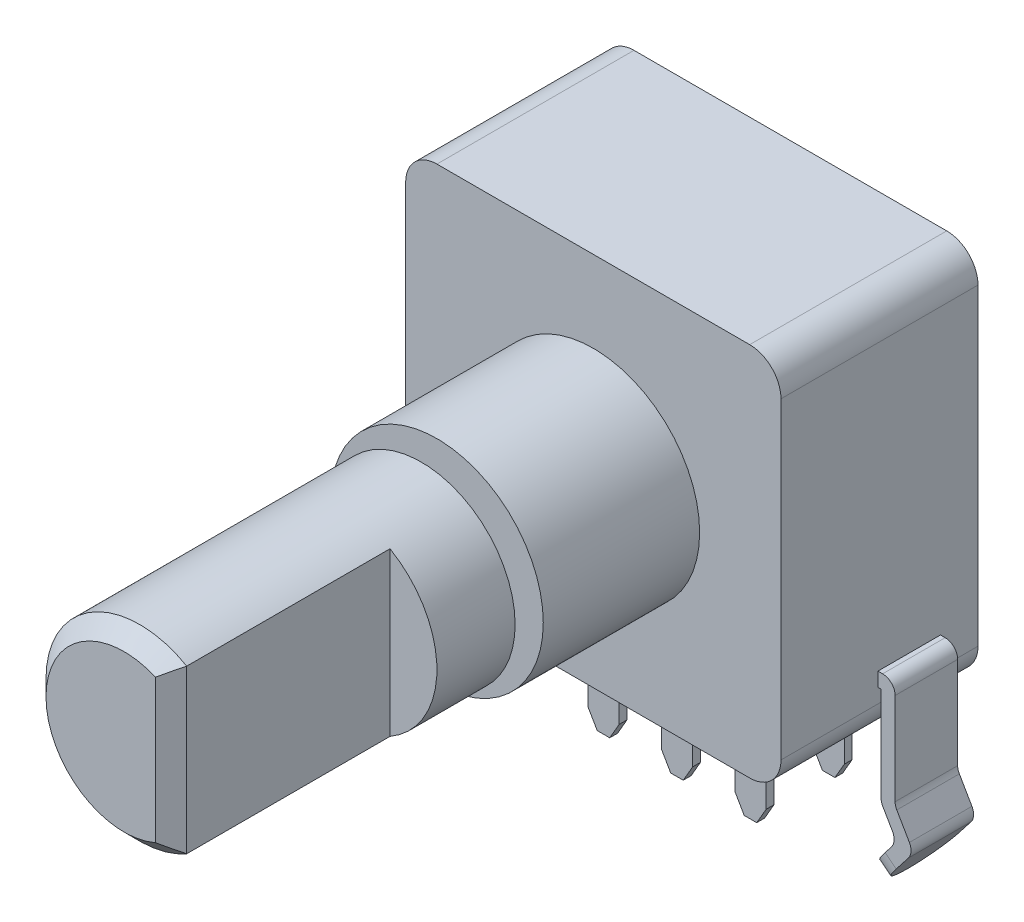
from build123d import *
from OCP.BRepFilletAPI import BRepFilletAPI_MakeChamfer

# Parameters (mm, degrees)
ESQUISSE1_W           = 12
ESQUISSE1_H           = 12
BOSS_EXTRU_1_DEPTH    = 6.3
ESQUISSE2_R           = 3.4
BOSS_EXTRU_2_DEPTH    = 5
ESQUISSE5_R           = 1.8
BOSS_EXTRU_5_DEPTH    = 0.5
ESQUISSE3_R           = 3
BOSS_EXTRU_3_DEPTH    = 2.5
BOSS_EXTRU_6_START    = 2.5
BOSS_EXTRU_6_DEPTH    = 7
ESQUISSE4_W           = 1
ESQUISSE4_H           = 0.25
BOSS_EXTRU_4_DEPTH    = 3.8
CHANFREIN1_SIZE       = 0.5
CONG_1_R              = 1
CHANFREIN2_SIZE       = 0.3
CHANFREIN2_SIZE2      = 0.519615242
BOSS_EXTRU_7_START    = -1.2
BOSS_EXTRU_7_DEPTH    = 2
CONG_2_R              = 1
CONG_2_OF_SYM_TRIE1_R = 1


with BuildPart() as part:
    # Esquisse1 → Boss.-Extru.1 (new body)
    with BuildSketch(Plane.XY):
        Rectangle(ESQUISSE1_W, ESQUISSE1_H)
    extrude(amount=BOSS_EXTRU_1_DEPTH)

    # Esquisse2 → Boss.-Extru.2 (add)
    with BuildSketch(Plane.XY.offset(6.3)):
        Circle(ESQUISSE2_R)
    extrude(amount=BOSS_EXTRU_2_DEPTH)

    # Esquisse5 → Boss.-Extru.5 (add)
    with BuildSketch(Plane.XY.offset(11.3)):
        Circle(ESQUISSE5_R)
    extrude(amount=BOSS_EXTRU_5_DEPTH)

    # Esquisse3 → Boss.-Extru.3 (add)
    with BuildSketch(Plane.XY.offset(11.8)):
        Circle(ESQUISSE3_R)
    extrude(amount=BOSS_EXTRU_3_DEPTH)

    # Esquisse3<4> → Boss.-Extru.6 (add)
    with BuildSketch(Plane.XY.offset(11.8).offset(BOSS_EXTRU_6_START)):
        with BuildLine():
            Line((1.5, 0.994987437), (1.5, 2.598076211))
            ThreePointArc((1.5, 2.598076211), (-3, 0), (1.5, -2.598076211))
            Line((1.5, -2.598076211), (1.5, -0.994987437))
            ThreePointArc((1.5, -0.994987437), (-1.8, 0), (1.5, 0.994987437))
        make_face()
        with BuildLine():
            Line((1.5, -0.994987437), (1.5, 0.994987437))
            ThreePointArc((1.5, 0.994987437), (-1.8, 0), (1.5, -0.994987437))
        make_face()
    extrude(amount=BOSS_EXTRU_6_DEPTH)

    # Esquisse4 → Boss.-Extru.4 (add)
    with BuildSketch(Plane.XZ.offset(6)):
        with Locations((0, 3.5)):
            Rectangle(ESQUISSE4_W, ESQUISSE4_H)
        with Locations((2.35, 3.5)):
            Rectangle(ESQUISSE4_W, ESQUISSE4_H)
        with Locations((-2.35, 3.5)):
            Rectangle(ESQUISSE4_W, ESQUISSE4_H)
        with Locations((-2.35, 1)):
            Rectangle(ESQUISSE4_W, ESQUISSE4_H)
        with Locations((2.35, 1)):
            Rectangle(ESQUISSE4_W, ESQUISSE4_H)
    extrude(amount=BOSS_EXTRU_4_DEPTH)

    # Chanfrein1
    chanfrein1_edges = [part.edges().sort_by_distance(p)[0] for p in [
        (1.5, 0, 21.3),
        (-3, 0, 21.3),
    ]]
    chamfer(chanfrein1_edges, length=CHANFREIN1_SIZE)

    # Congé1
    cong_1_edges = [part.edges().sort_by_distance(p)[0] for p in [
        (6, -6, 3.15),
        (-6, -6, 3.15),
        (-6, 6, 3.15),
        (6, 6, 3.15),
    ]]
    fillet(cong_1_edges, radius=CONG_1_R)

    # Chanfrein2: one chamfer whose edges measure the first distance from different faces: ONE call of the kernel's chamfer builder (chamfer() names one face for all edges)
    chanfrein2_edges_1 = [part.edges().sort_by_distance(p)[0] for p in [
        (0.5, -6, 3.5),
    ]]
    chanfrein2_side_1 = [part.faces().sort_by_distance(p)[0] for p in [
        (0.5, -7.9, 3.5),
    ]]
    chanfrein2_edges_2 = [part.edges().sort_by_distance(p)[0] for p in [
        (-0.5, -6, 3.5),
    ]]
    chanfrein2_side_2 = [part.faces().sort_by_distance(p)[0] for p in [
        (-0.5, -7.9, 3.5),
    ]]
    chanfrein2_edges_3 = [part.edges().sort_by_distance(p)[0] for p in [
        (0.5, -9.8, 3.5),
        (-0.5, -9.8, 3.5),
    ]]
    chanfrein2_side_3 = [part.faces().sort_by_distance(p)[0] for p in [
        (0, -9.8, 3.5),
    ]]
    chanfrein2_edges_4 = [part.edges().sort_by_distance(p)[0] for p in [
        (2.85, -6, 3.5),
    ]]
    chanfrein2_side_4 = [part.faces().sort_by_distance(p)[0] for p in [
        (2.85, -7.9, 3.5),
    ]]
    chanfrein2_edges_5 = [part.edges().sort_by_distance(p)[0] for p in [
        (1.85, -6, 3.5),
    ]]
    chanfrein2_side_5 = [part.faces().sort_by_distance(p)[0] for p in [
        (1.85, -7.9, 3.5),
    ]]
    chanfrein2_edges_6 = [part.edges().sort_by_distance(p)[0] for p in [
        (2.85, -9.8, 3.5),
        (1.85, -9.8, 3.5),
    ]]
    chanfrein2_side_6 = [part.faces().sort_by_distance(p)[0] for p in [
        (2.35, -9.8, 3.5),
    ]]
    chanfrein2_edges_7 = [part.edges().sort_by_distance(p)[0] for p in [
        (-1.85, -6, 3.5),
    ]]
    chanfrein2_side_7 = [part.faces().sort_by_distance(p)[0] for p in [
        (-1.85, -7.9, 3.5),
    ]]
    chanfrein2_edges_8 = [part.edges().sort_by_distance(p)[0] for p in [
        (-2.85, -6, 3.5),
    ]]
    chanfrein2_side_8 = [part.faces().sort_by_distance(p)[0] for p in [
        (-2.85, -7.9, 3.5),
    ]]
    chanfrein2_edges_9 = [part.edges().sort_by_distance(p)[0] for p in [
        (-1.85, -9.8, 3.5),
        (-2.85, -9.8, 3.5),
    ]]
    chanfrein2_side_9 = [part.faces().sort_by_distance(p)[0] for p in [
        (-2.35, -9.8, 3.5),
    ]]
    chanfrein2_edges_10 = [part.edges().sort_by_distance(p)[0] for p in [
        (-1.85, -6, 1),
    ]]
    chanfrein2_side_10 = [part.faces().sort_by_distance(p)[0] for p in [
        (-1.85, -7.9, 1),
    ]]
    chanfrein2_edges_11 = [part.edges().sort_by_distance(p)[0] for p in [
        (-2.85, -6, 1),
    ]]
    chanfrein2_side_11 = [part.faces().sort_by_distance(p)[0] for p in [
        (-2.85, -7.9, 1),
    ]]
    chanfrein2_edges_12 = [part.edges().sort_by_distance(p)[0] for p in [
        (-1.85, -9.8, 1),
        (-2.85, -9.8, 1),
    ]]
    chanfrein2_side_12 = [part.faces().sort_by_distance(p)[0] for p in [
        (-2.35, -9.8, 1),
    ]]
    chanfrein2_edges_13 = [part.edges().sort_by_distance(p)[0] for p in [
        (2.85, -6, 1),
    ]]
    chanfrein2_side_13 = [part.faces().sort_by_distance(p)[0] for p in [
        (2.85, -7.9, 1),
    ]]
    chanfrein2_edges_14 = [part.edges().sort_by_distance(p)[0] for p in [
        (1.85, -6, 1),
    ]]
    chanfrein2_side_14 = [part.faces().sort_by_distance(p)[0] for p in [
        (1.85, -7.9, 1),
    ]]
    chanfrein2_edges_15 = [part.edges().sort_by_distance(p)[0] for p in [
        (2.85, -9.8, 1),
        (1.85, -9.8, 1),
    ]]
    chanfrein2_side_15 = [part.faces().sort_by_distance(p)[0] for p in [
        (2.35, -9.8, 1),
    ]]
    chanfrein2 = BRepFilletAPI_MakeChamfer(part.part.solid().wrapped)
    for e in chanfrein2_edges_1:
        chanfrein2.Add(CHANFREIN2_SIZE, CHANFREIN2_SIZE2, e.wrapped, chanfrein2_side_1[0].wrapped)  # the first distance lies on this face
    for e in chanfrein2_edges_2:
        chanfrein2.Add(CHANFREIN2_SIZE, CHANFREIN2_SIZE2, e.wrapped, chanfrein2_side_2[0].wrapped)  # the first distance lies on this face
    for e in chanfrein2_edges_3:
        chanfrein2.Add(CHANFREIN2_SIZE, CHANFREIN2_SIZE2, e.wrapped, chanfrein2_side_3[0].wrapped)  # the first distance lies on this face
    for e in chanfrein2_edges_4:
        chanfrein2.Add(CHANFREIN2_SIZE, CHANFREIN2_SIZE2, e.wrapped, chanfrein2_side_4[0].wrapped)  # the first distance lies on this face
    for e in chanfrein2_edges_5:
        chanfrein2.Add(CHANFREIN2_SIZE, CHANFREIN2_SIZE2, e.wrapped, chanfrein2_side_5[0].wrapped)  # the first distance lies on this face
    for e in chanfrein2_edges_6:
        chanfrein2.Add(CHANFREIN2_SIZE, CHANFREIN2_SIZE2, e.wrapped, chanfrein2_side_6[0].wrapped)  # the first distance lies on this face
    for e in chanfrein2_edges_7:
        chanfrein2.Add(CHANFREIN2_SIZE, CHANFREIN2_SIZE2, e.wrapped, chanfrein2_side_7[0].wrapped)  # the first distance lies on this face
    for e in chanfrein2_edges_8:
        chanfrein2.Add(CHANFREIN2_SIZE, CHANFREIN2_SIZE2, e.wrapped, chanfrein2_side_8[0].wrapped)  # the first distance lies on this face
    for e in chanfrein2_edges_9:
        chanfrein2.Add(CHANFREIN2_SIZE, CHANFREIN2_SIZE2, e.wrapped, chanfrein2_side_9[0].wrapped)  # the first distance lies on this face
    for e in chanfrein2_edges_10:
        chanfrein2.Add(CHANFREIN2_SIZE, CHANFREIN2_SIZE2, e.wrapped, chanfrein2_side_10[0].wrapped)  # the first distance lies on this face
    for e in chanfrein2_edges_11:
        chanfrein2.Add(CHANFREIN2_SIZE, CHANFREIN2_SIZE2, e.wrapped, chanfrein2_side_11[0].wrapped)  # the first distance lies on this face
    for e in chanfrein2_edges_12:
        chanfrein2.Add(CHANFREIN2_SIZE, CHANFREIN2_SIZE2, e.wrapped, chanfrein2_side_12[0].wrapped)  # the first distance lies on this face
    for e in chanfrein2_edges_13:
        chanfrein2.Add(CHANFREIN2_SIZE, CHANFREIN2_SIZE2, e.wrapped, chanfrein2_side_13[0].wrapped)  # the first distance lies on this face
    for e in chanfrein2_edges_14:
        chanfrein2.Add(CHANFREIN2_SIZE, CHANFREIN2_SIZE2, e.wrapped, chanfrein2_side_14[0].wrapped)  # the first distance lies on this face
    for e in chanfrein2_edges_15:
        chanfrein2.Add(CHANFREIN2_SIZE, CHANFREIN2_SIZE2, e.wrapped, chanfrein2_side_15[0].wrapped)  # the first distance lies on this face
    add(Compound.cast(chanfrein2.Shape()), mode=Mode.REPLACE)

    # Esquisse6 → Boss.-Extru.7 (add)
    with BuildSketch(Plane(origin=(0, 0, 0), x_dir=(-1, 0, 0), z_dir=(0, 0, -1)).offset(BOSS_EXTRU_7_START)):
        with BuildLine():
            Line((-6, -4.090148625), (-6.15, -4.090148625))
            ThreePointArc((-6.15, -4.090148625), (-6.432842712, -4.207305912), (-6.55, -4.490148625))
            Line((-6.55, -4.490148625), (-6.55, -7.432968948))
            ThreePointArc((-6.55, -7.432968948), (-6.563629669, -7.536496566), (-6.603589838, -7.632968948))
            Line((-6.603589838, -7.632968948), (-7.006574145, -8.330958241))
            ThreePointArc((-7.006574145, -8.330958241), (-7.059189603, -8.55886083), (-6.975368285, -8.777222831))
            Line((-6.975368285, -8.777222831), (-5.969546479, -10.064616035))
            Line((-5.969546479, -10.064616035), (-5.614941639, -9.787568371))
            Line((-5.614941639, -9.787568371), (-6.433892437, -8.739359151))
            ThreePointArc((-6.433892437, -8.739359151), (-6.517713755, -8.52099715), (-6.465098297, -8.293094561))
            Line((-6.465098297, -8.293094561), (-6.153589838, -7.753546084))
            ThreePointArc((-6.153589838, -7.753546084), (-6.113629669, -7.657073702), (-6.1, -7.553546084))
            Line((-6.1, -7.553546084), (-6.1, -4.540148625))
            Line((-6.1, -4.540148625), (-6, -4.540148625))
            Line((-6, -4.540148625), (-6, -4.090148625))
        make_face()
    boss_extru_7 = extrude(amount=-BOSS_EXTRU_7_DEPTH)

    # Congé2
    cong_2_edges = [part.edges().sort_by_distance(p)[0] for p in [
        (5.792244059, -9.926092203, 1.2),
        (5.792244059, -9.926092203, 3.2),
    ]]
    fillet(cong_2_edges, radius=CONG_2_R - 0.0001)  # a hair under: the kernel refuses the full size

    # Symétrie1: Boss.-Extru.7 across plane
    add(boss_extru_7.mirror(Plane(origin=(0, 0, 0), x_dir=(0, 0, 1), z_dir=(1, 0, 0))))

    # Congé2 of Symétrie1
    cong_2_of_sym_trie1_edges = [part.edges().sort_by_distance(p)[0] for p in [
        (-5.792244059, -9.926092203, 1.2),
        (-5.792244059, -9.926092203, 3.2),
    ]]
    fillet(cong_2_of_sym_trie1_edges, radius=CONG_2_OF_SYM_TRIE1_R - 0.0001)  # a hair under: the kernel refuses the full size


solid = part.part
